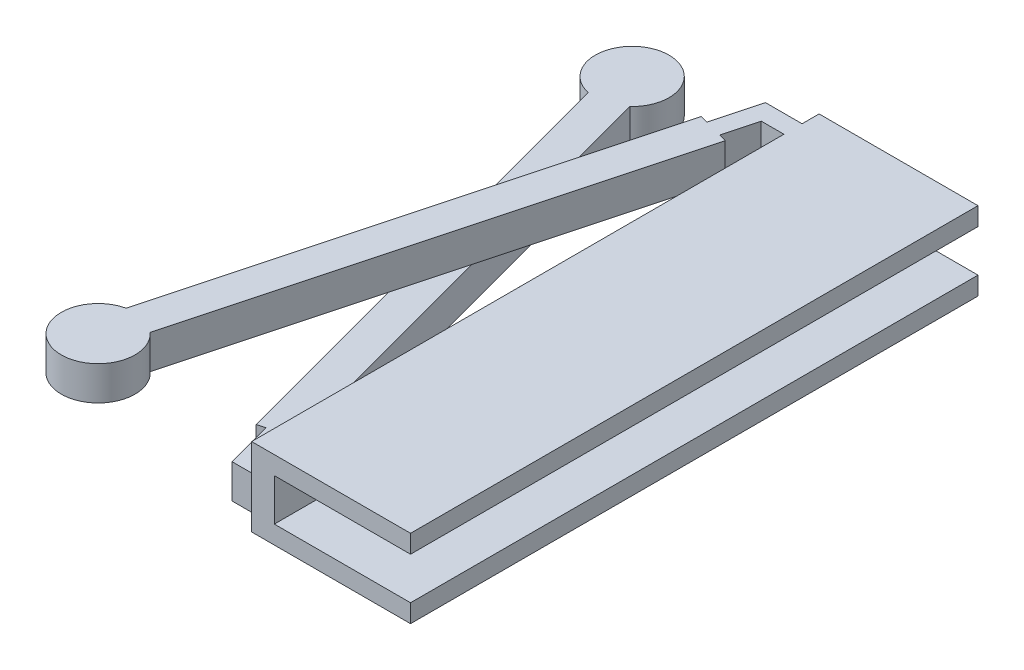
from build123d import *

# Parameters (mm, degrees)
BOSS_EXTRUDE1_DEPTH = 50
BOSS_EXTRUDE2_DEPTH = 3
CIRPATTERN1_COUNT   = 2


with BuildPart() as part:
    # Sketch2 → Boss-Extrude1 (new body)
    with BuildSketch(Plane.XY):
        Polygon((0, 0), (0, 6.9), (14, 6.9), (14, 5.3), (2, 5.3), (2, 1.6), (14, 1.6), (14, 0), align=None)
    extrude(amount=BOSS_EXTRUDE1_DEPTH)

    # Sketch3 → Boss-Extrude2 (add)
    with BuildSketch(Plane(origin=(0, 6.9, 0), x_dir=(1, 0, 0), z_dir=(0, 1, 0))):
        with BuildLine():
            Line((0, -3.1), (0, -1.5))
            Line((0, -1.5), (-3.227723181, -1.5))
            Line((-3.227723181, -1.5), (-4.321938457, -5.583667007))
            Line((-4.321938457, -5.583667007), (-4.998086536, -5.402493675))
            Line((-4.998086536, -5.402493675), (-15.70267703, -45.352569273))
            ThreePointArc((-15.70267703, -45.352569273), (-15.841161897, -51.66495679), (-12.804899551, -46.129026409))
            Line((-12.804899551, -46.129026409), (-2.100309057, -6.17895081))
            Line((-2.100309057, -6.17895081), (-2.776457135, -5.997777479))
            Line((-2.776457135, -5.997777479), (-2, -3.1))
            Line((-2, -3.1), (0, -3.1))
        make_face()
    boss_extrude2 = extrude(amount=-BOSS_EXTRUDE2_DEPTH)

    # CirPattern1: Boss-Extrude2 ×2 about axis
    cirpattern1_axis = Axis((-0.7, 3.45, 25), (1, 0, 0))
    for i in range(1, CIRPATTERN1_COUNT):
        add(boss_extrude2.rotate(cirpattern1_axis, i * 360 / CIRPATTERN1_COUNT))


solid = part.part
